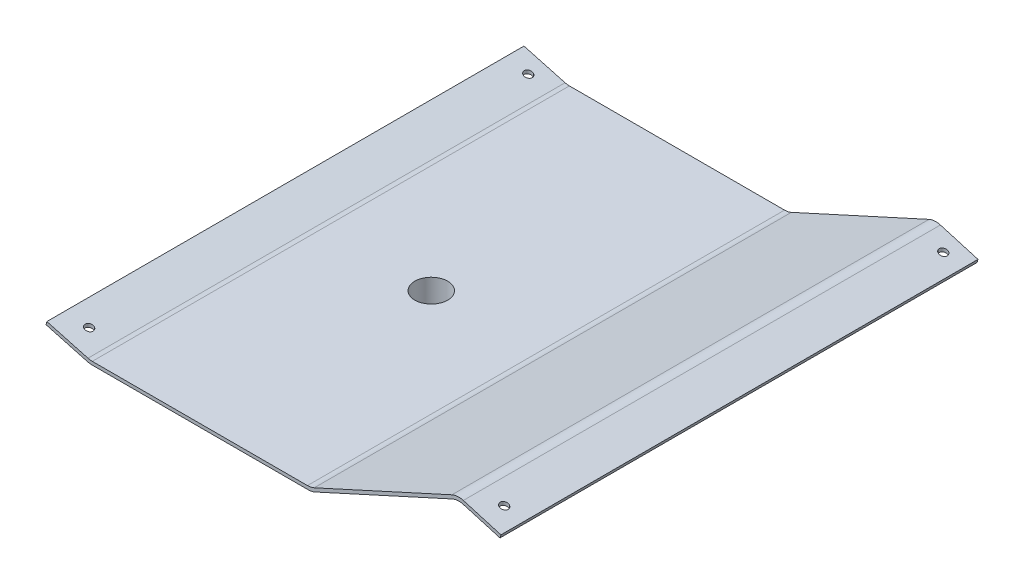
from build123d import *

# Parameters (mm, degrees)
BOSS_EXTRUDE1_DEPTH = 290
SKETCH2_R           = 60
BOSS_EXTRUDE2_DEPTH = 5
DOME1_FACE_RADIUS   = 60
DOME1_HEIGHT        = 30
FILLET1_R           = 10
SKETCH3_R           = 10
CUT_EXTRUDE1_DEPTH  = 335.423734017
FILLET2_R           = 10
FILLET3_R           = 10
SKETCH8_R           = 2.42
SKETCH8_R_2         = 2.420000001
CUT_EXTRUDE2_DEPTH  = 40


with BuildPart() as part:
    # Sketch1 → Boss-Extrude1 (new body)
    with BuildSketch(Plane.XY):
        Polygon((0, 0), (-135, 0), (-161.533498532, 7.226579802), (-161.007929092, 9.156288786), (-134.732514829, 2), (-0.434386742, 2), (88.562311317, 42.572930951), (114.981959712, 34.864758374), (114.421796177, 32.944806079), (88.715656235, 40.444806079), align=None)
    extrude(amount=BOSS_EXTRUDE1_DEPTH)

    # Sketch2 → Boss-Extrude2 (add)
    with BuildSketch(Plane(origin=(0, 2, 0), x_dir=(1, 0, 0), z_dir=(0, 1, 0))):
        with Locations(Location((-67.583450785, -149.769450313, 0), (0, 0, 270))):
            Circle(SKETCH2_R)
    extrude(amount=-BOSS_EXTRUDE2_DEPTH)

    # Dome1: a dome of height H over a round flat face of radius A is a cap of a sphere of radius (A * A + H * H) / (2 * H)
    dome1_r = (DOME1_FACE_RADIUS * DOME1_FACE_RADIUS + DOME1_HEIGHT * DOME1_HEIGHT) / (2 * DOME1_HEIGHT)
    dome1_base = Plane((-67.583450785, -3, 149.769450313), z_dir=(0, -1, 0))
    with Locations(dome1_base.offset(DOME1_HEIGHT - dome1_r)):
        dome1_ball = Sphere(dome1_r, mode=Mode.PRIVATE)
    add(split(dome1_ball, bisect_by=dome1_base, keep=Keep.TOP, mode=Mode.PRIVATE))

    # Fillet1
    # the kernel refuses this fillet: 10 mm, written as the material it takes off along each edge
    with BuildSketch(Plane(origin=(-67.583450785, -3, 149.769450313), x_dir=(4.089410291877963e-12, 0, -1.0), z_dir=(1.0, 0, 4.089410291877963e-12))) as fillet1_piece_1:
        with BuildLine():
            CenterArc((50.011565498, 3.480807854), FILLET1_R, 320.300820282, 36.943291115)
            Line((57.705652497, -2.906760168), (57.859534237, -3.034511529))
            ThreePointArc((57.859534237, -3.034511529), (59.02775796, -1.591456193), (60.16, -0.12))
            Line((60.16, -0.12), (60.2, 0))
            ThreePointArc((60.2, 0), (60.2, 1.5), (60.19976869, 2.990383843))
            Line((60.19976869, 2.990383843), (60, 3))
        make_face()
    revolve(axis=Axis((-67.583450785, -3, 149.769450313), (0, 1, 0)), revolution_arc=180, mode=Mode.SUBTRACT)
    with BuildSketch(Plane(origin=(-67.583450785, -3, 149.769450313), x_dir=(0, 0, 1), z_dir=(-1, 0, 0))) as fillet1_piece_2:
        with BuildLine():
            CenterArc((50.011565498, 3.480807853), FILLET1_R, 320.300820281, 36.94329112)
            Line((57.705652497, -2.906760169), (57.859534237, -3.03451153))
            ThreePointArc((57.859534237, -3.03451153), (59.02775796, -1.591456194), (60.16, -0.12))
            Line((60.16, -0.12), (60.2, 0))
            ThreePointArc((60.2, 0), (60.2, 1.5), (60.19976869, 2.990383843))
            Line((60.19976869, 2.990383843), (60, 3))
        make_face()
    revolve(axis=Axis((-67.583450785, -3, 149.769450313), (0, 1, 0)), revolution_arc=180, mode=Mode.SUBTRACT)

    # Sketch3 → Cut-Extrude1 (cut, through all)
    with BuildSketch(Plane(origin=(0, 2, 0), x_dir=(1, 0, 0), z_dir=(0, 1, 0))):
        with Locations(Location((-67.583450785, -149.769450313, 0), (0, 0, 270))):
            Circle(SKETCH3_R)
    extrude(amount=-CUT_EXTRUDE1_DEPTH, mode=Mode.SUBTRACT)

    # Fillet2
    fillet2_edges = [part.edges().sort_by_distance(p)[0] for p in [
        (88.562311317, 42.572930951, 145),
        (88.715656235, 40.444806079, 145),
    ]]
    fillet(fillet2_edges, radius=FILLET2_R)

    # Fillet3
    fillet3_edges = [part.edges().sort_by_distance(p)[0] for p in [
        (0, 0, 145),
        (-135, 0, 145),
        (-134.732514829, 2, 145),
        (-0.434386742, 2, 145),
    ]]
    fillet(fillet3_edges, radius=FILLET3_R)

    # Sketch8 → Cut-Extrude2 (cut)
    with BuildSketch(Plane(origin=(0, 0, 0), x_dir=(1, 0, 0), z_dir=(0, 1, 0))):
        with Locations((-148.387339129, -10.01871293)):
            Circle(SKETCH8_R)
        with Locations((103.912660871, -10.01871293)):
            Circle(SKETCH8_R)
        with Locations((103.912660871, -276.91871293)):
            Circle(SKETCH8_R)
        with Locations((-148.387339129, -276.91871293)):
            Circle(SKETCH8_R_2)
    extrude(amount=CUT_EXTRUDE2_DEPTH, mode=Mode.SUBTRACT)


solid = part.part
